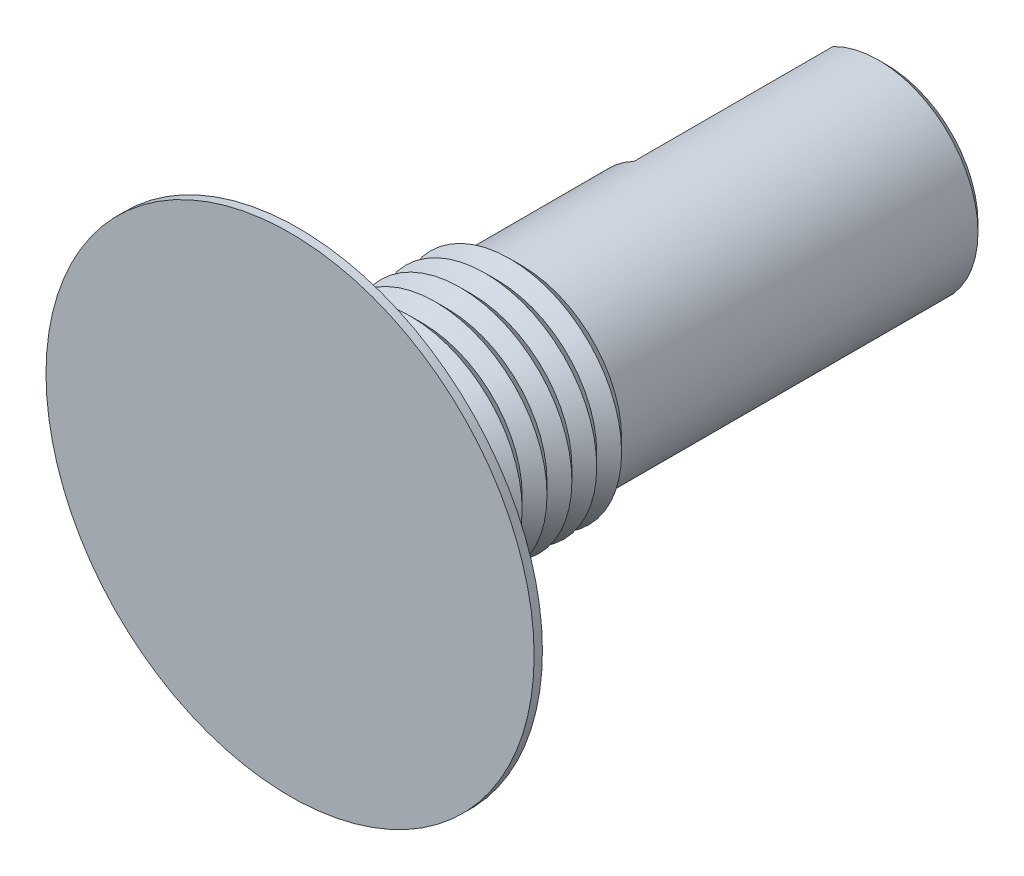
from build123d import *

# Parameters (mm, degrees)
SKETCH1_R           = 7.479732897
BOSS_EXTRUDE1_DEPTH = 0.254
SKETCH2_R           = 3.429
BOSS_EXTRUDE2_DEPTH = 0.762
CHAMFER1_SIZE       = 0.381
LPATTERN3_COUNT     = 9
LPATTERN3_PITCH     = 0.762
SKETCH3_R           = 3.048
BOSS_EXTRUDE3_DEPTH = 11.176
CUT_EXTRUDE1_DEPTH  = 6.35
CHAMFER2_SIZE       = 0.254


with BuildPart() as part:
    # Sketch1 → Boss-Extrude1 (new body)
    with BuildSketch(Plane.XY):
        Circle(SKETCH1_R)
    extrude(amount=BOSS_EXTRUDE1_DEPTH)


with BuildPart() as body_2:
    # Sketch2 → Boss-Extrude2 (new body)
    with BuildSketch(Plane(origin=(0, 0, 0), x_dir=(-1, 0, 0), z_dir=(0, 0, -1))):
        with Locations(Location((0, 0, 0), (0, 0, 180))):
            Circle(SKETCH2_R)
    extrude(amount=BOSS_EXTRUDE2_DEPTH)

    # Chamfer1
    chamfer1_edges = [body_2.edges().sort_by_distance(p)[0] for p in [
        (-3.429, 0, 0),
        (-3.429, 0, -0.762),
    ]]
    chamfer(chamfer1_edges, length=CHAMFER1_SIZE - 0.0001)  # a hair under: the kernel refuses the full size


with BuildPart() as lpattern3_1:
    # LPattern3: pattern copy
    add(body_2.part.moved(Location(Vector(0, 0, -1) * (1 * LPATTERN3_PITCH))))


with BuildPart() as lpattern3_2:
    # LPattern3: pattern copy
    add(body_2.part.moved(Location(Vector(0, 0, -1) * (2 * LPATTERN3_PITCH))))


with BuildPart() as lpattern3_3:
    # LPattern3: pattern copy
    add(body_2.part.moved(Location(Vector(0, 0, -1) * (3 * LPATTERN3_PITCH))))


with BuildPart() as lpattern3_4:
    # LPattern3: pattern copy
    add(body_2.part.moved(Location(Vector(0, 0, -1) * (4 * LPATTERN3_PITCH))))


with BuildPart() as lpattern3_5:
    # LPattern3: pattern copy
    add(body_2.part.moved(Location(Vector(0, 0, -1) * (5 * LPATTERN3_PITCH))))


with BuildPart() as lpattern3_6:
    # LPattern3: pattern copy
    add(body_2.part.moved(Location(Vector(0, 0, -1) * (6 * LPATTERN3_PITCH))))


with BuildPart() as lpattern3_7:
    # LPattern3: pattern copy
    add(body_2.part.moved(Location(Vector(0, 0, -1) * (7 * LPATTERN3_PITCH))))


with BuildPart() as lpattern3_8:
    # LPattern3: pattern copy
    add(body_2.part.moved(Location(Vector(0, 0, -1) * (8 * LPATTERN3_PITCH))))

    # Sketch3 → Boss-Extrude3 (add)
    with BuildSketch(Plane(origin=(0, 0, -6.858), x_dir=(-1, 0, 0), z_dir=(0, 0, -1))):
        with Locations(Location((0, 0, 0), (0, 0, 180))):
            Circle(SKETCH3_R)
    extrude(amount=BOSS_EXTRUDE3_DEPTH)

    # Sketch4 → Cut-Extrude1 (cut)
    with BuildSketch(Plane(origin=(0, 0, -18.034), x_dir=(-1, 0, 0), z_dir=(0, 0, -1))):
        with BuildLine():
            Line((1.397, 2.709002584), (1.397, -2.709002584))
            ThreePointArc((1.397, -2.709002584), (3.048, 0), (1.397, 2.709002584))
        make_face()
    extrude(amount=-CUT_EXTRUDE1_DEPTH, mode=Mode.SUBTRACT)

    # Chamfer2
    chamfer2_edges = [lpattern3_8.edges().sort_by_distance(p)[0] for p in [
        (1.586229492, -2.602725495, -18.034),
    ]]
    chamfer(chamfer2_edges, length=CHAMFER2_SIZE)


solid = Compound([part.part, body_2.part, lpattern3_1.part, lpattern3_2.part, lpattern3_3.part, lpattern3_4.part, lpattern3_5.part, lpattern3_6.part, lpattern3_7.part, lpattern3_8.part])
